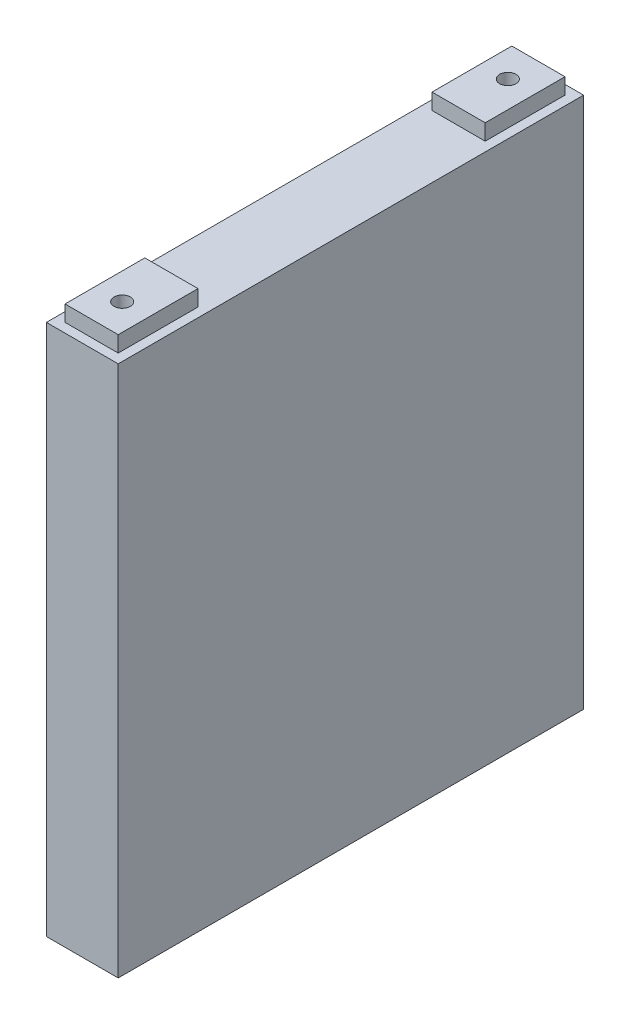
from build123d import *

# Parameters (mm, degrees)
SKETCH1_W           = 27
SKETCH1_H           = 175
BOSS_EXTRUDE1_DEPTH = 200
SKETCH2_W           = 20
SKETCH2_H           = 30
SKETCH2_R           = 3.071880825
BOSS_EXTRUDE2_DEPTH = 6


with BuildPart() as part:
    # Sketch1 → Boss-Extrude1 (new body)
    with BuildSketch(Plane(origin=(0, 0, 0), x_dir=(1, 0, 0), z_dir=(0, 1, 0))):
        Rectangle(SKETCH1_W, SKETCH1_H)
    extrude(amount=BOSS_EXTRUDE1_DEPTH)

    # Sketch2 → Boss-Extrude2 (add)
    # profile 1 of 2: a face of its own
    with BuildSketch(Plane(origin=(0, 200, 0), x_dir=(1, 0, 0), z_dir=(0, 1, 0))):
        with Locations((0, -69)):
            Rectangle(SKETCH2_W, SKETCH2_H)
        with Locations((0, -72.5)):
            Circle(SKETCH2_R, mode=Mode.SUBTRACT)
    # profile 2 of 2: a face of its own
    with BuildSketch(Plane(origin=(0, 200, 0), x_dir=(1, 0, 0), z_dir=(0, 1, 0))):
        with Locations((0, 69)):
            Rectangle(SKETCH2_W, SKETCH2_H)
        with Locations((0, 72.5)):
            Circle(SKETCH2_R, mode=Mode.SUBTRACT)
    extrude(amount=BOSS_EXTRUDE2_DEPTH)


solid = part.part
